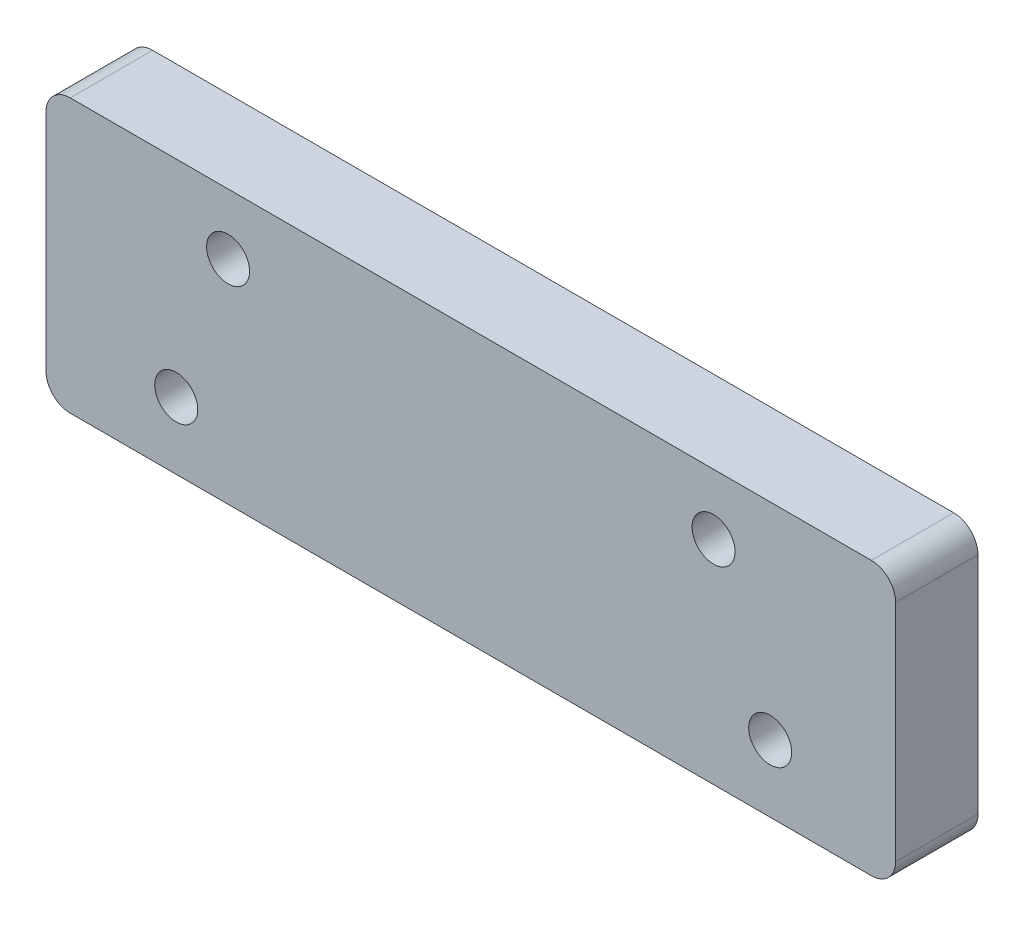
from build123d import *

# Parameters (mm, degrees)
SKETCH1_W                      = 88.9
SKETCH1_H                      = 15.875
BOSS_EXTRUDE1_DEPTH            = 7.62
CBORE_FOR_M4_SHCS1_D           = 4.5
CBORE_FOR_M4_SHCS1_CBORE_D     = 8
CBORE_FOR_M4_SHCS1_CBORE_DEPTH = 4
BOSS_EXTRUDE2_START            = 1
SKETCH4_W                      = 88.9
SKETCH4_H                      = 15.875
SKETCH4_R                      = 4
BOSS_EXTRUDE2_DEPTH            = 1
SKETCH5_W                      = 88.9
SKETCH5_H                      = 12.7
BOSS_EXTRUDE3_DEPTH            = 8.62
M4_CLEARANCE_HOLE1_D           = 4.5
FILLET1_R                      = 2.54


with BuildPart() as part:
    # Sketch1 → Boss-Extrude1 (new body)
    with BuildSketch(Plane.XY):
        with Locations((61.9, 7.9375)):
            Rectangle(SKETCH1_W, SKETCH1_H)
    extrude(amount=-BOSS_EXTRUDE1_DEPTH)

    # CBORE for M4 SHCS1 (through all)
    with Locations(Plane(origin=(0, 0, -7.62), x_dir=(-1, 0, 0), z_dir=(0, 0, -1))):
        with Locations((-93.225, 7), (-31.075, 7)):
            CounterBoreHole(CBORE_FOR_M4_SHCS1_D / 2, CBORE_FOR_M4_SHCS1_CBORE_D / 2, CBORE_FOR_M4_SHCS1_CBORE_DEPTH)

    # Sketch4 → Boss-Extrude2 (add)
    with BuildSketch(Plane(origin=(0, 0, -7.62), x_dir=(-1, 0, 0), z_dir=(0, 0, -1)).offset(BOSS_EXTRUDE2_START)):
        with Locations((-61.9, 7.9375)):
            Rectangle(SKETCH4_W, SKETCH4_H)
        with Locations((-31.075, 7)):
            Circle(SKETCH4_R, mode=Mode.SUBTRACT)
        with Locations((-93.225, 7)):
            Circle(SKETCH4_R, mode=Mode.SUBTRACT)
    extrude(amount=-BOSS_EXTRUDE2_DEPTH)

    # Sketch5 → Boss-Extrude3 (add)
    with BuildSketch(Plane.XY):
        with Locations((61.9, 22.225)):
            Rectangle(SKETCH5_W, SKETCH5_H)
    extrude(amount=-BOSS_EXTRUDE3_DEPTH)

    # M4 Clearance Hole1 (through all)
    with Locations(Plane.XY):
        with Locations((36.5, 22.225), (87.3, 22.225)):
            Hole(M4_CLEARANCE_HOLE1_D / 2)

    # Fillet1
    fillet1_edges = [part.edges().sort_by_distance(p)[0] for p in [
        (106.35, 28.575, -4.31),
        (106.35, 0, -4.31),
        (17.45, 0, -4.31),
        (17.45, 28.575, -4.31),
    ]]
    fillet(fillet1_edges, radius=FILLET1_R)


solid = part.part
